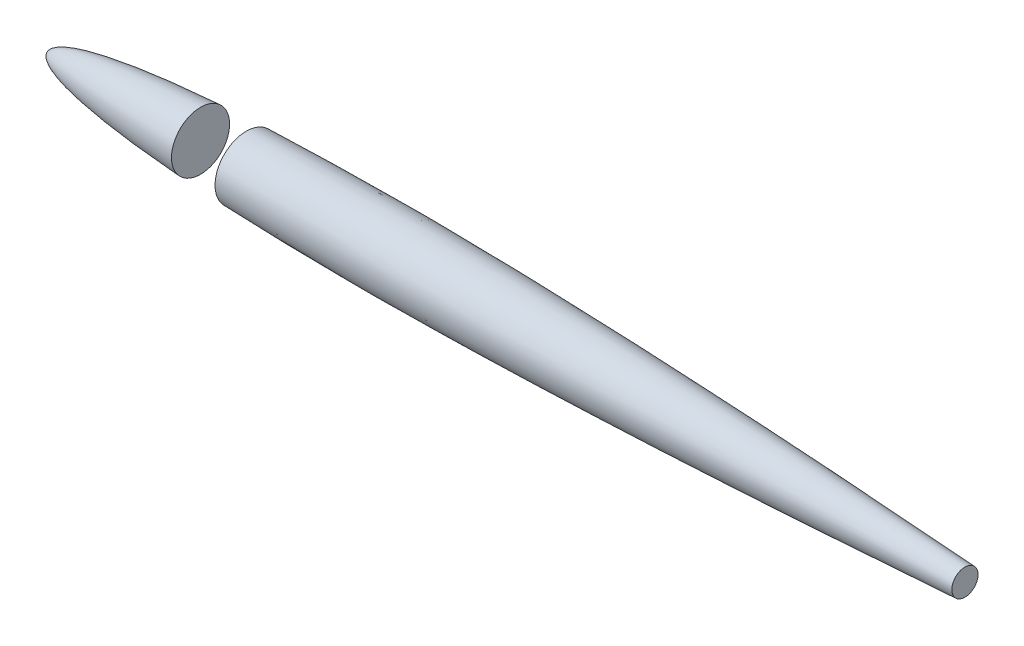
from build123d import *

# Parameters (mm, degrees)
CUTSKETCH_R        = 330
CUT_EXTRUDE1_DEPTH = 9033.067959266
SKETCH1_W          = 450
SKETCH1_H          = 1500


with BuildPart() as part:
    # rootSketch → Revolve1 (revolve)
    with BuildSketch(Plane(origin=(0, 0, 0), x_dir=(1, 0, 0), z_dir=(0, 1, 0))):
        with BuildLine():
            Line((0, 0), (10999.999999956, 0))
            add(Edge.make_bspline(
                [(0, 0), (0.000193085, 1.416582005), (0.122535707, 4.240766735), (0.673873379, 8.454686711), (2.109656818, 13.93845879), (4.130019916, 19.114733958), (6.6108994, 23.964322659), (9.99141312, 29.368131534), (13.807367772, 34.371487293), (18.005055091, 39.082436475), (24.006567174, 45.012475537), (32.38394762, 52.235407337), (43.384048479, 60.194382801), (57.076069362, 68.618071155), (73.982979094, 77.724284629), (92.789267205, 86.643497962), (113.957785626, 95.516746756), (137.455558775, 104.311070441), (166.299503437, 114.136034239), (201.291019257, 124.83380424), (243.070199966, 136.204737597), (291.673004407, 147.963968929), (341.243287097, 158.777969553), (390.608018364, 168.603047356), (439.719156269, 177.608967602), (500.651651233, 187.980684512), (573.469223954, 199.282575084), (658.612232457, 211.186619601), (758.084154261, 223.607887379), (859.684753543, 234.995657417), (963.386980877, 245.464526813), (1069.170635517, 255.102838422), (1175.032596375, 263.835414151), (1280.957756037, 271.761542521), (1386.934581972, 278.961621427), (1492.954015963, 285.502236936), (1625.576964573, 292.926255548), (1784.827209806, 300.723903315), (1970.72108882, 308.376208714), (2183.266072594, 315.387382688), (2395.855799019, 320.860371187), (2608.476211675, 324.955727138), (2821.116716449, 327.806853247), (3033.769186051, 329.526860496), (3299.591922937, 330.384071895), (3618.580812409, 329.51376865), (3990.720403141, 326.052290468), (4415.985201528, 319.209100208), (4841.201558049, 309.857365651), (5266.363404579, 298.307410519), (5691.467689334, 284.815055747), (6116.513213618, 269.590680129), (6541.499783516, 252.805736724), (6966.427609798, 234.597307498), (7391.296846876, 215.071528971), (7816.107239786, 194.306117476), (8187.764015612, 175.096544249), (8506.288418891, 157.904884619), (8771.698784382, 143.095088026), (8984.01062255, 130.95609045), (9196.305479291, 118.523403252), (9382.048027901, 107.38440154), (9541.24447253, 97.647382898), (9673.900203702, 89.404934778), (9780.020008578, 82.733097615), (9912.663326878, 74.294734048), (10032.03499694, 66.58027009), (10138.136351112, 59.627723881), (10230.971046534, 53.471278218), (10284.016761583, 49.932402374), (10337.064143493, 46.372127364), (10390.104279802, 42.790919783), (10443.152990441, 39.18744375), (10496.183419271, 35.563459924), (10549.240167305, 31.915530826), (10602.249493916, 28.248814521), (10655.332945198, 24.554271665), (10708.28973189, 20.846283715), (10761.453592237, 17.100380429), (10814.258157127, 13.357501973), (10861.039415372, 10.020132172), (10900.208423325, 7.212345677), (10934.336848159, 4.754530233), (10958.871036751, 2.983522743), (10981.803250473, 1.321442896), (10993.97273069, 0.438031797), (10999.999999956, 0)],
                knots=[0, 0, 0, 0, 0, 0.000464454, 0.000928907, 0.001393361, 0.001857814, 0.002287128, 0.002716441, 0.003486019, 0.003922473, 0.004358926, 0.005488094, 0.007117503, 0.008377929, 0.009638355, 0.011796648, 0.013954941, 0.015918589, 0.017882237, 0.021809533, 0.025977713, 0.030145893, 0.034314073, 0.038482253, 0.042518279, 0.046554305, 0.054626357, 0.062698409, 0.070770462, 0.079497478, 0.088224494, 0.09695151, 0.105678526, 0.114405542, 0.123132558, 0.131859574, 0.14058659, 0.158058513, 0.175530436, 0.193002359, 0.210474282, 0.227946206, 0.24541813, 0.262890054, 0.280361977, 0.315305825, 0.350249672, 0.38519352, 0.420137368, 0.455081215, 0.490025063, 0.524968911, 0.559912758, 0.594856606, 0.629800453, 0.664744301, 0.699688149, 0.717160073, 0.734631996, 0.75210392, 0.769575844, 0.787047768, 0.79578373, 0.804519691, 0.813255653, 0.821991615, 0.839463539, 0.84383152, 0.848199501, 0.852567482, 0.856935463, 0.861303444, 0.865671425, 0.870039406, 0.874407387, 0.878775368, 0.883143349, 0.88751133, 0.891879311, 0.896247292, 0.900615273, 0.902799263, 0.904983254, 0.907167244, 0.909351235, 0.909351235, 0.909351235, 0.909351235, 0.909351235], degree=4))
        make_face()
    revolve(axis=Axis((0, 0, 0), (1, 0, 0)))

    # cutSketch → Cut-Extrude1 (cut, through all)
    with BuildSketch(Plane(origin=(9020, 0, 0), x_dir=(0, 0, -1), z_dir=(1, 0, 0))):
        Circle(CUTSKETCH_R)
    extrude(amount=CUT_EXTRUDE1_DEPTH, mode=Mode.SUBTRACT)

    # Sketch1 → Cut-Revolve2 (revolve, cut)
    with BuildSketch(Plane(origin=(0, 0, 0), x_dir=(1, 0, 0), z_dir=(0, 1, 0))):
        with Locations((1725, 750)):
            Rectangle(SKETCH1_W, SKETCH1_H)
    revolve(axis=Axis((0, 0, 0), (1, 0, 0)), mode=Mode.SUBTRACT)


with BuildPart() as cut_revolve2_piece_1:
    # of the separate pieces the step leaves, piece 1, a body of its own (cut_revolve2_pieces)
    add(part.part.solids().sort_by_distance((1950, 0, -307.236509207))[0])


with BuildPart() as cut_revolve2_piece_2:
    # of the separate pieces the step leaves, piece 2, a body of its own (cut_revolve2_pieces)
    add(part.part.solids().sort_by_distance((1500, 0, -285.789342783))[0])


solid = Compound([cut_revolve2_piece_1.part, cut_revolve2_piece_2.part])
